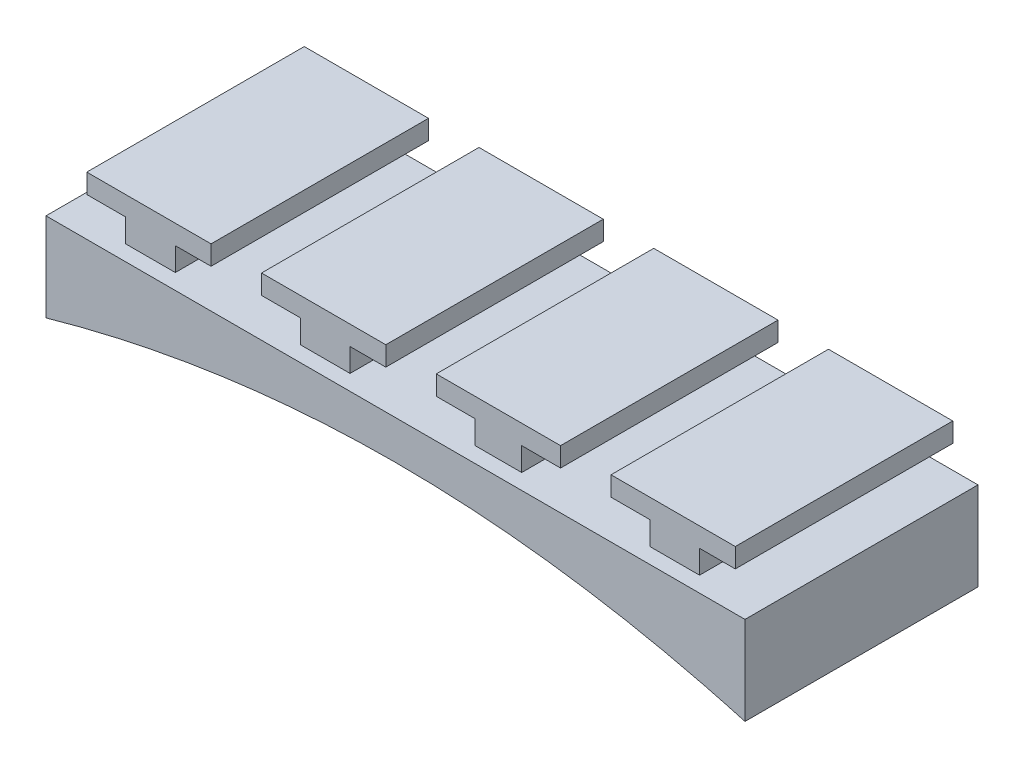
from build123d import *

# Parameters (mm, degrees)
BOSS_EXTRUDE1_DEPTH = 30
BOSS_EXTRUDE3_DEPTH = 28


with BuildPart() as part:
    # Sketch1 → Boss-Extrude1 (new body)
    with BuildSketch(Plane.XY):
        with BuildLine():
            Line((32.618514969, 11.38178113), (-57.381485031, 11.38178113))
            Line((-57.381485031, 11.38178113), (-57.381485031, 0))
            add(Edge.make_bspline(
                [(-57.381485031, 0), (-12.381485031, 12.76356226), (32.618514969, 0)],
                knots=[0, 0, 0, 1, 1, 1], degree=2))
            Line((32.618514969, 0), (32.618514969, 11.38178113))
        make_face()
    extrude(amount=BOSS_EXTRUDE1_DEPTH)

    # Sketch2 → Boss-Extrude3 (add)
    with BuildSketch(Plane(origin=(0, 0, 0), x_dir=(-1, 0, 0), z_dir=(0, 0, -1))):
        Polygon((-24.764099839, 11.38178113), (-24.764099839, 14.38178113), (-29.368514969, 14.38178113), (-29.368514969, 16.88178113), (-13.368514969, 16.88178113), (-13.368514969, 14.38178113), (-18.368514969, 14.38178113), (-18.368514969, 11.38178113), align=None)
        Polygon((42.732833925, 11.38178113), (42.732833925, 14.38178113), (38.131485031, 14.38178113), (38.131485031, 16.88178113), (54.131485031, 16.88178113), (54.131485031, 14.38178113), (49.131485031, 14.38178113), (49.131485031, 11.38178113), align=None)
        Polygon((20.232833925, 11.38178113), (20.232833925, 14.38178113), (15.631485031, 14.38178113), (15.631485031, 16.88178113), (31.631485031, 16.88178113), (31.631485031, 14.38178113), (26.631485031, 14.38178113), (26.631485031, 11.38178113), align=None)
        Polygon((-1.868514969, 11.38178113), (-1.868514969, 14.38178113), (-6.868514969, 14.38178113), (-6.868514969, 16.88178113), (9.131485031, 16.88178113), (9.131485031, 14.38178113), (4.131485031, 14.38178113), (4.131485031, 11.38178113), align=None)
    extrude(amount=-BOSS_EXTRUDE3_DEPTH)


solid = part.part
